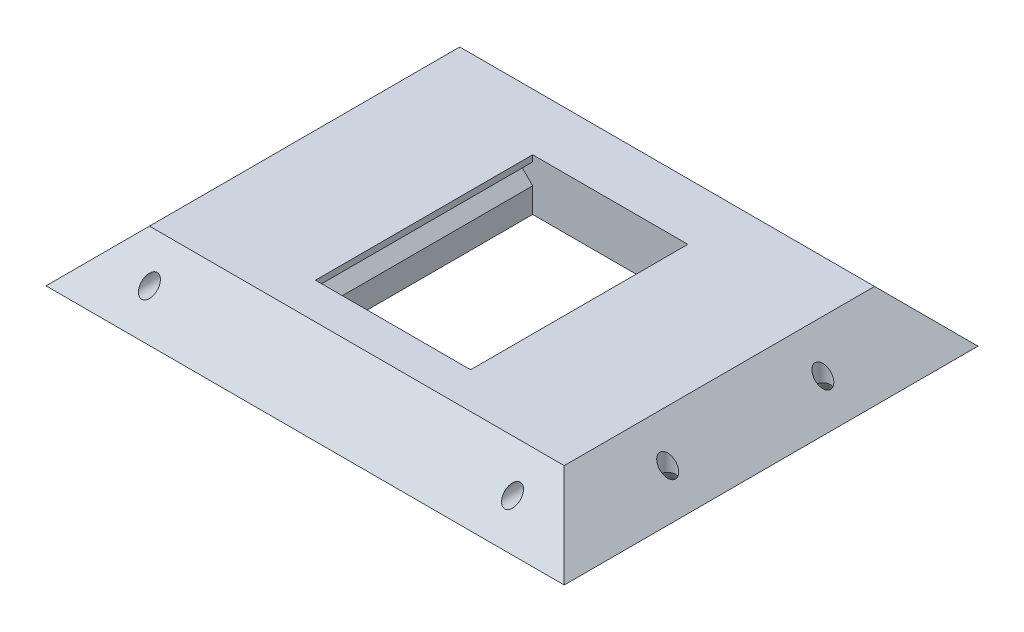
from build123d import *

# Parameters (mm, degrees)
SKETCH_4_R          = 1.5
CUT_EXTRUDE_1_DEPTH = 20
SKETCH_5_R          = 1.5
CUT_EXTRUDE_2_DEPTH = 65.884590004
SKETCH3_W           = 30
SKETCH3_H           = 42
CUT_EXTRUDE1_DEPTH  = 65.884590004
CUT_EXTRUDE2_DEPTH  = 42


with BuildPart() as part:
    # Эскиз1 → По сечениям1 section 0
    with BuildSketch(Plane(origin=(0, 0, 0), x_dir=(1, 0, 0), z_dir=(0, 1, 0))):
        with BuildLine():
            Line((-50.1, -40), (50.1, -40))
            Line((50.1, -40), (50.1, 40))
            Line((50.1, 40), (-50.1, 40))
            Line((-50.1, 40), (-50.1, -40))
        make_face()
    # Эскиз2 → По сечениям1 section 1
    with BuildSketch(Plane(origin=(0, 10, 0), x_dir=(1, 0, 0), z_dir=(0, 1, 0))):
        with BuildLine():
            Line((40.1, -30), (40.1, 30))
            Line((40.1, 30), (-40.1, 30))
            Line((-40.1, 30), (-40.1, -30))
            Line((-40.1, -30), (40.1, -30))
        make_face()
    loft()

    # Эскиз4 → Вырез-Вытянуть1 (cut)
    with BuildSketch(Plane.XY.offset(40)):
        with Locations((-35.1, 5)):
            Circle(SKETCH_4_R)
        with Locations(Location((35.1, 5, 0), (0, 0, 270))):
            Circle(SKETCH_4_R)
    cut_extrude_1 = extrude(amount=-CUT_EXTRUDE_1_DEPTH, mode=Mode.SUBTRACT)

    # Зеркальное отражение1: Вырез-Вытянуть1 across plane
    add(cut_extrude_1.mirror(Plane.XY), mode=Mode.SUBTRACT)

    # Эскиз5 → Вырез-Вытянуть2 (cut, through all)
    with BuildSketch(Plane.XZ):
        with Locations(Location((-45.1, 15, 0), (0, 0, 270))):
            Circle(SKETCH_5_R)
        with Locations(Location((-45.1, -15, 0), (0, 0, 180))):
            Circle(SKETCH_5_R)
        with Locations(Location((45.1, -15, 0), (0, 0, 270))):
            Circle(SKETCH_5_R)
        with Locations((45.1, 15)):
            Circle(SKETCH_5_R)
    extrude(amount=-CUT_EXTRUDE_2_DEPTH, mode=Mode.SUBTRACT)

    # Cut-Loft1: read off the stored shape, not the designer's step
    # Cut-Loft1: loft between two sections, ruled curve by curve
    cut_loft1_from = [
        Edge.make_bspline([(-43.923484762, 2.8, 15.930490137), (-45.784465036, 2.8, 18.283520613), (-48.137495512, 2.8, 16.422540339), (-46.276515238, 2.8, 14.069509863), (-44.415534964, 2.8, 11.716479387), (-42.062504488, 2.8, 13.577459661), (-43.923484762, 2.8, 15.930490137)], [0, 0, 0, 0, 0.5, 0.5, 0.5, 1, 1, 1, 1], 3, [1, 0.333333333, 0.333333333, 1, 0.333333333, 0.333333333, 1]),
    ]
    cut_loft1_to = [
        Edge.make_bspline([(-43.881334244, 0, 18.066733405), (-50.014801053, 0, 20.504064917), (-52.452132565, 0, 14.370598107), (-46.318665756, 0, 11.933266595), (-40.185198947, 0, 9.495935083), (-37.747867435, 0, 15.629401893), (-43.881334244, 0, 18.066733405)], [0, 0, 0, 0, 0.5, 0.5, 0.5, 1, 1, 1, 1], 3, [1, 0.333333333, 0.333333333, 1, 0.333333333, 0.333333333, 1]),
    ]
    cut_loft1 = Solid(Shell([*[Face.make_surface_from_curves(cut_loft1_from[k], cut_loft1_to[k]) for k in range(1)], Face(Wire(cut_loft1_from)), Face(Wire(cut_loft1_to))]))
    add(cut_loft1, mode=Mode.SUBTRACT)

    # Mirror1: Cut-Loft1 across plane
    add(cut_loft1.mirror(Plane.XY), mode=Mode.SUBTRACT)

    # Mirror2: read off the stored shape, not the designer's step
    # Mirror2: loft between two sections, ruled curve by curve
    mirror2_from = [
        Edge.make_bspline([(43.923484762, 2.8, 15.930490137), (45.784465036, 2.8, 18.283520613), (48.137495512, 2.8, 16.422540339), (46.276515238, 2.8, 14.069509863), (44.415534964, 2.8, 11.716479387), (42.062504488, 2.8, 13.577459661), (43.923484762, 2.8, 15.930490137)], [0, 0, 0, 0, 0.5, 0.5, 0.5, 1, 1, 1, 1], 3, [1, 0.333333333, 0.333333333, 1, 0.333333333, 0.333333333, 1]),
    ]
    mirror2_to = [
        Edge.make_bspline([(43.881334244, 0, 18.066733405), (50.014801053, 0, 20.504064917), (52.452132565, 0, 14.370598107), (46.318665756, 0, 11.933266595), (40.185198947, 0, 9.495935083), (37.747867435, 0, 15.629401893), (43.881334244, 0, 18.066733405)], [0, 0, 0, 0, 0.5, 0.5, 0.5, 1, 1, 1, 1], 3, [1, 0.333333333, 0.333333333, 1, 0.333333333, 0.333333333, 1]),
    ]
    mirror2 = Solid(Shell([*[Face.make_surface_from_curves(mirror2_from[k], mirror2_to[k]) for k in range(1)], Face(Wire(mirror2_from)), Face(Wire(mirror2_to))]))
    add(mirror2, mode=Mode.SUBTRACT)

    # Mirror2 2: loft between two sections, ruled curve by curve
    mirror2_2_from = [
        Edge.make_bspline([(43.923484762, 2.8, -15.930490137), (45.784465036, 2.8, -18.283520613), (48.137495512, 2.8, -16.422540339), (46.276515238, 2.8, -14.069509863), (44.415534964, 2.8, -11.716479387), (42.062504488, 2.8, -13.577459661), (43.923484762, 2.8, -15.930490137)], [0, 0, 0, 0, 0.5, 0.5, 0.5, 1, 1, 1, 1], 3, [1, 0.333333333, 0.333333333, 1, 0.333333333, 0.333333333, 1]),
    ]
    mirror2_2_to = [
        Edge.make_bspline([(43.881334244, 0, -18.066733405), (50.014801053, 0, -20.504064917), (52.452132565, 0, -14.370598107), (46.318665756, 0, -11.933266595), (40.185198947, 0, -9.495935083), (37.747867435, 0, -15.629401893), (43.881334244, 0, -18.066733405)], [0, 0, 0, 0, 0.5, 0.5, 0.5, 1, 1, 1, 1], 3, [1, 0.333333333, 0.333333333, 1, 0.333333333, 0.333333333, 1]),
    ]
    mirror2_2 = Solid(Shell([*[Face.make_surface_from_curves(mirror2_2_from[k], mirror2_2_to[k]) for k in range(1)], Face(Wire(mirror2_2_from)), Face(Wire(mirror2_2_to))]))
    add(mirror2_2, mode=Mode.SUBTRACT)

    # Sketch3 → Cut-Extrude1 (cut, through all)
    with BuildSketch(Plane.XZ):
        with Locations((0, 2)):
            Rectangle(SKETCH3_W, SKETCH3_H)
    extrude(amount=-CUT_EXTRUDE1_DEPTH, mode=Mode.SUBTRACT)

    # Sketch4 → Cut-Extrude2 (cut)
    with BuildSketch(Plane.XY.offset(-19)):
        Polygon((-15, 8.8), (-17, 6.8), (-15, 4.8), align=None)
        Polygon((15, 4.8), (15, 8.8), (17, 6.8), align=None)
    extrude(amount=CUT_EXTRUDE2_DEPTH, mode=Mode.SUBTRACT)


solid = part.part
